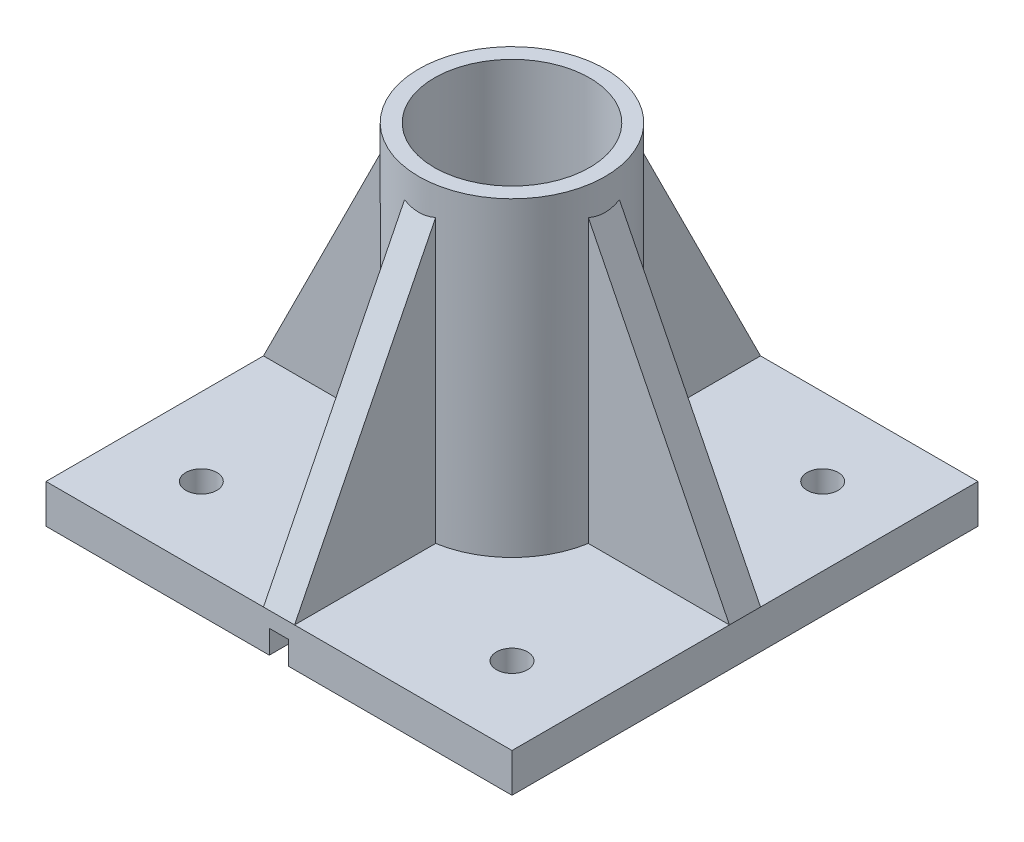
from build123d import *
from build123d.topology import SkipClean

# Parameters (mm, degrees)
BASISVLAK_W          = 60
BASISVLAK_H          = 60
BASIS_DEPTH          = 5
CIRKELS_HOUDER_R     = 12
CIRKELS_HOUDER_R_2   = 10
HOUDER_DEPTH         = 40
CIRKEL_GAT_R         = 2
GATEN_DEPTH          = 59.309518948
GAT_KABELS_REACH     = 63.847
CIRKEL_GAT_KABELS_R  = 2.5
RIBBE_START          = -2
RIBBE_DEPTH          = 4
RIBBEN_PATROON_COUNT = 4
GLEUF_REACH          = 82.777
GLEUF_END_RADIUS     = 2.5
VIERKANT_BASIS_W     = 2.5
VIERKANT_BASIS_H     = 3


# Read off the part's stored shape, not the designer's step: Ribbe
with BuildPart() as part:
    # Basisvlak → Basis (new body)
    with BuildSketch(Plane(origin=(0, 0, 0), x_dir=(1, 0, 0), z_dir=(0, 1, 0))):
        Rectangle(BASISVLAK_W, BASISVLAK_H)
    extrude(amount=BASIS_DEPTH)

    # Cirkels houder → Houder (add)
    with BuildSketch(Plane(origin=(0, 5, 0), x_dir=(1, 0, 0), z_dir=(0, 1, 0))):
        with Locations(Location((0, 0, 0), (0, 0, 90))):
            Circle(CIRKELS_HOUDER_R)
        with Locations(Location((0, 0, 0), (0, 0, 270))):
            Circle(CIRKELS_HOUDER_R_2, mode=Mode.SUBTRACT)
    extrude(amount=HOUDER_DEPTH)

    # Cirkel gat → Gaten (cut, through all)
    with BuildSketch(Plane(origin=(0, 5, 0), x_dir=(1, 0, 0), z_dir=(0, 1, 0))):
        with Locations(Location((-20, -20, 0), (0, 0, 270))):
            Circle(CIRKEL_GAT_R)
        with Locations(Location((20, -20, 0), (0, 0, 270))):
            Circle(CIRKEL_GAT_R)
        with Locations(Location((-20, 20, 0), (0, 0, 270))):
            Circle(CIRKEL_GAT_R)
        with Locations(Location((20, 20, 0), (0, 0, 270))):
            Circle(CIRKEL_GAT_R)
    extrude(amount=-GATEN_DEPTH, mode=Mode.SUBTRACT)

    # Cirkel gat kabels → Gat kabels (cut, up to next)
    with BuildSketch(Plane(origin=(0, 0, 0), x_dir=(-1, 0, 0), z_dir=(0, -1, 0)), mode=Mode.PRIVATE) as gat_kabels_sk1:
        with Locations(Location((0, 0, 0), (0, 0, 90))):
            Circle(CIRKEL_GAT_KABELS_R)
    gat_kabels_tool1 = extrude(gat_kabels_sk1.sketch, amount=-GAT_KABELS_REACH, mode=Mode.PRIVATE) & part.part
    add(gat_kabels_tool1.solids().sort_by_distance((0, 0, 0))[0], mode=Mode.SUBTRACT)

    # Ribbe outline → Ribbe (add)
    with BuildSketch(Plane(origin=(0, 0, 0), x_dir=(0, 0, -1), z_dir=(1, 0, 0)).offset(RIBBE_START)):
        Polygon((30, 5), (11, 43), (10, 43), (10, 5), align=None)
    ribbe = extrude(amount=RIBBE_DEPTH)

    # Ribben patroon: Ribbe ×4 about axis
    with SkipClean():  # the faces are left unmerged after this step: merging them gives an invalid solid
        ribben_patroon_axis = Axis((0, 0, 0), (0, 1, 0))
        for i in range(1, RIBBEN_PATROON_COUNT):
            add(ribbe.rotate(ribben_patroon_axis, i * 360 / RIBBEN_PATROON_COUNT))

    # Gleuf: up to this cylinder (the profile starts outside it)
    with SkipClean():  # the faces are left unmerged after this step: merging them gives an invalid solid
        gleuf_end = Plane(origin=(0, 1.5, 0), z_dir=(0, -1, 0)) * Cylinder(GLEUF_END_RADIUS, 171.554, mode=Mode.PRIVATE)
        # vierkant_basis → Gleuf (cut, up to the surface)
        with BuildSketch(Plane.XY.offset(30), mode=Mode.PRIVATE) as gleuf_sk1:
            with Locations((0, 1.5)):
                Rectangle(VIERKANT_BASIS_W, VIERKANT_BASIS_H)
        gleuf_tool1 = extrude(gleuf_sk1.sketch, amount=-GLEUF_REACH, mode=Mode.PRIVATE) - gleuf_end
        add(gleuf_tool1.solids().sort_by_distance((0, 1.5, 30))[0], mode=Mode.SUBTRACT)


solid = part.part
